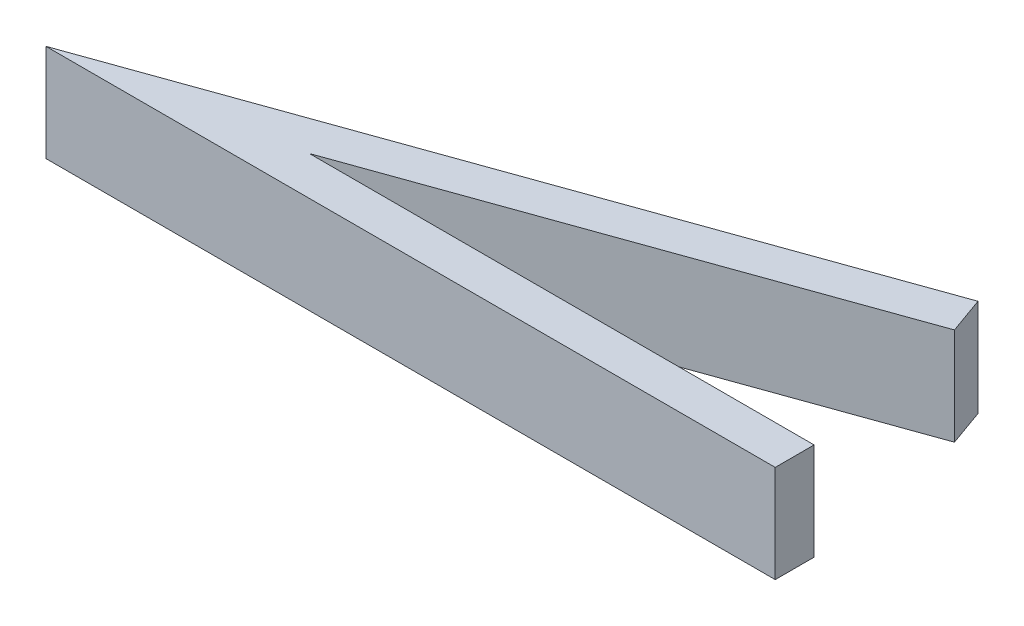
from build123d import *

# Parameters (mm, degrees)
BOSS_EXTRUDE1_DEPTH = 20


with BuildPart() as part:
    # Sketch1 → Boss-Extrude1 (new body)
    with BuildSketch(Plane(origin=(0, 0, 0), x_dir=(1, 0, 0), z_dir=(0, 1, 0))):
        Polygon((0, 0), (112.679677005, 0), (112.679677005, 8), (8.8653869, 8), (106.631654889, 42.916524362), (103.940963707, 50.450459653), (-37.320322995, 0), align=None)
    extrude(amount=BOSS_EXTRUDE1_DEPTH)


solid = part.part
